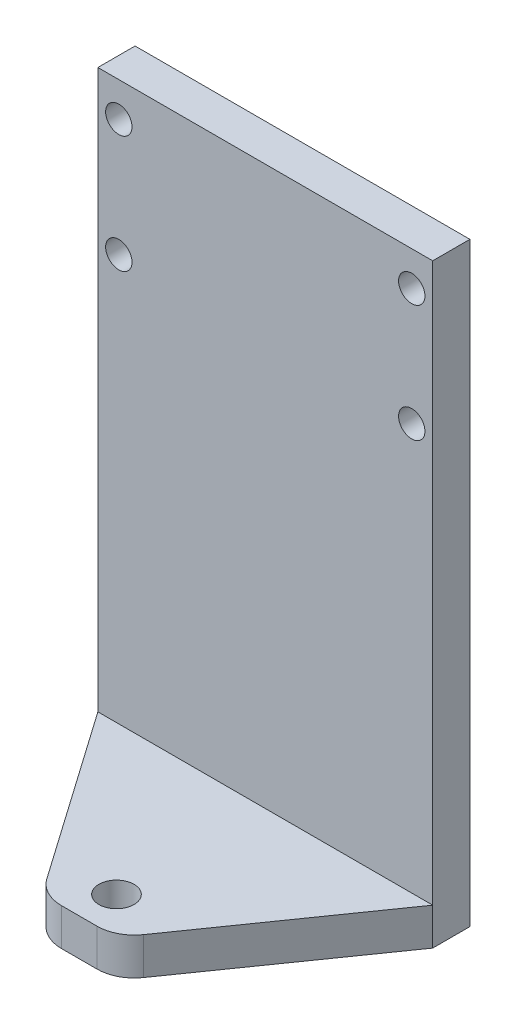
from build123d import *

# Parameters (mm, degrees)
SKETCH1_W           = 57.15
SKETCH1_H           = 101.6
BOSS_EXTRUDE1_DEPTH = 3.175
SKETCH2_W           = 57.15
SKETCH2_H           = 57.15
BOSS_EXTRUDE2_DEPTH = 6.35
SKETCH3_R           = 2.25
CUT_EXTRUDE1_DEPTH  = 82.628996839
SKETCH4_R           = 3
CUT_EXTRUDE2_DEPTH  = 114.147663476
CUT_EXTRUDE3_DEPTH  = 114.147663476
FILLET1_R           = 6.35


with BuildPart() as part:
    # Sketch1 → Boss-Extrude1 (new, symmetric)
    with BuildSketch(Plane.XY):
        Rectangle(SKETCH1_W, SKETCH1_H)
    extrude(amount=BOSS_EXTRUDE1_DEPTH, both=True)

    # Sketch2 → Boss-Extrude2 (add)
    with BuildSketch(Plane.XZ.offset(50.8)):
        with Locations((0, 25.4)):
            Rectangle(SKETCH2_W, SKETCH2_H)
    extrude(amount=-BOSS_EXTRUDE2_DEPTH)

    # Sketch3 → Cut-Extrude1 (cut, through all)
    with BuildSketch(Plane(origin=(0, 0, -3.175), x_dir=(-1, 0, 0), z_dir=(0, 0, -1))):
        with Locations((-25, 44.925)):
            Circle(SKETCH3_R)
        with Locations((-25, 24.925)):
            Circle(SKETCH3_R)
        with Locations((25, 24.925)):
            Circle(SKETCH3_R)
        with Locations((25, 44.925)):
            Circle(SKETCH3_R)
    extrude(amount=-CUT_EXTRUDE1_DEPTH, mode=Mode.SUBTRACT)

    # Sketch4 → Cut-Extrude2 (cut, through all)
    with BuildSketch(Plane(origin=(0, -44.45, 0), x_dir=(1, 0, 0), z_dir=(0, 1, 0))):
        with Locations((0, -28.575)):
            Circle(SKETCH4_R)
    extrude(amount=-CUT_EXTRUDE2_DEPTH, mode=Mode.SUBTRACT)

    # Sketch5 → Cut-Extrude3 (cut, through all)
    with BuildSketch(Plane(origin=(0, -44.45, 0), x_dir=(1, 0, 0), z_dir=(0, 1, 0))):
        Polygon((-28.575, -3.175), (-6.35, -34.925), (6.35, -34.925), (28.575, -3.175), (28.575, -53.975), (-28.575, -53.975), align=None)
    extrude(amount=-CUT_EXTRUDE3_DEPTH, mode=Mode.SUBTRACT)

    # Fillet1
    fillet1_edges = [part.edges().sort_by_distance(p)[0] for p in [
        (6.35, -47.625, 34.925),
        (-6.35, -47.625, 34.925),
    ]]
    fillet(fillet1_edges, radius=FILLET1_R)


solid = part.part
